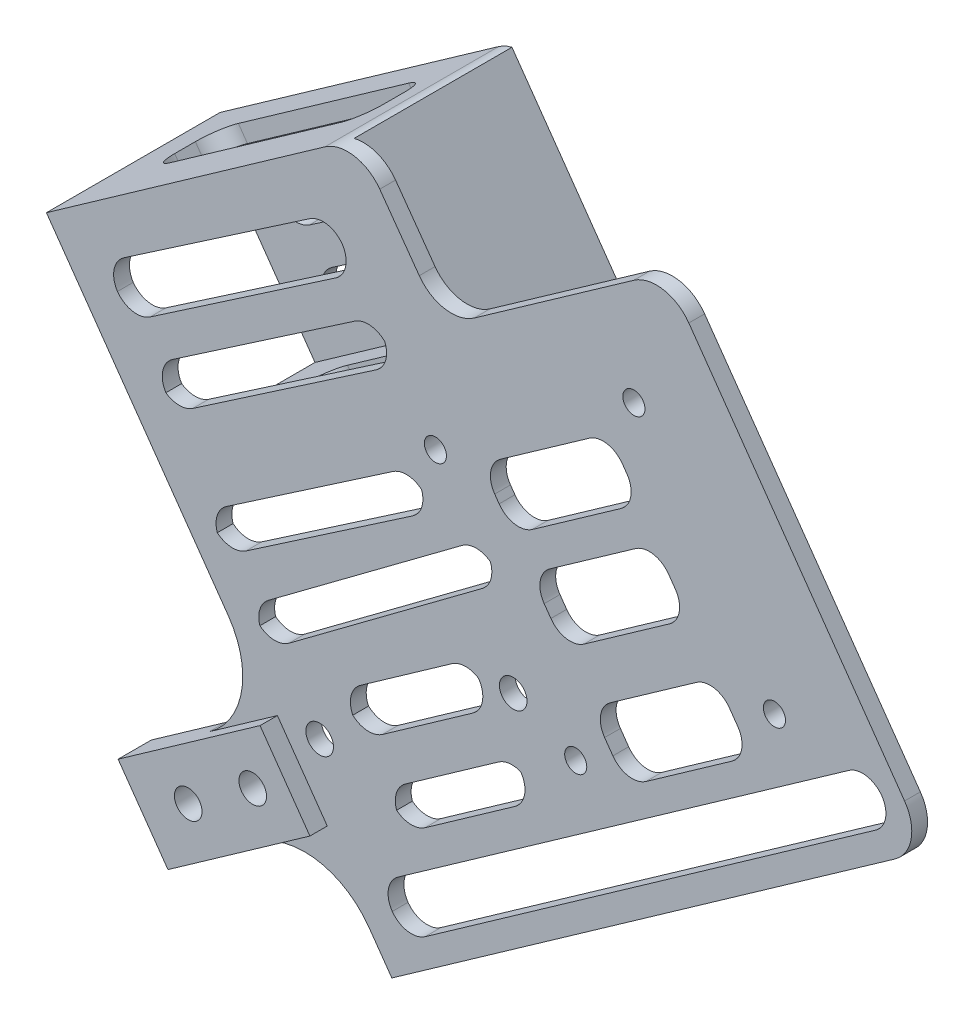
from build123d import *

# Parameters (mm, degrees)
SKETCH_1_R                = 2.1
EXTRUDE_1_DEPTH           = 2
EXTRUDE_2_DEPTH           = 40
EXTRUDE_3_DEPTH           = 2
FILLET_1_R                = 10
SKETCH_10_R               = 2.075
EXTRUDE_4_DEPTH           = 2
SKETCH_14_R               = 3.5715559825460215
CUT_EXTRUDE_6_DEPTH       = 4
SKETCH_15_R               = 2.075
EXTRUDE_6_DEPTH           = 2
SKETCH_16_R               = 3.75
CUT_EXTRUDE_7_DEPTH       = 2
FILLET_6_R                = 10
EXTRUDE_7_DEPTH           = 2
FILLET_7_R                = 10
CUT_EXTRUDE_8_DEPTH       = 39.00000000000002
CUT_EXTRUDE_9_DEPTH       = 1
CUT_EXTRUDE_9_DEPTH_BACK  = 1
EXTRUDE_8_DEPTH           = 20
EXTRUDE_9_DEPTH           = 43
SKETCH_23_R               = 1.7500000000000038
CUT_EXTRUDE_10_DEPTH      = 32
EXTRUDE_11_DEPTH          = 2.0000000000000036
M3X0_5_1_D                = 2.8
CUT_EXTRUDE_11_DEPTH      = 61.00000000000001
CUT_EXTRUDE_11_DEPTH_BACK = 9.000000000000002
CUT_EXTRUDE_12_DEPTH      = 9.000000000000002
SKETCH_32_W               = 32.392419007521774
SKETCH_32_H               = 8.622442469611897
CUT_EXTRUDE_13_DEPTH      = 43.000000000000014
FILLET_START              = -21
FILLET_8_DEPTH            = 24
FILLET_8_2_DEPTH          = 2
FILLET_10_R               = 3
FILLET_11_R               = 3
SKETCH_33_W               = 2.00000000000002
SKETCH_33_H               = 10.963872604458993
CUT_EXTRUDE_14_DEPTH      = 55.000000000000014
CUT_EXTRUDE_15_DEPTH      = 55.000000000000014
CUT_EXTRUDE_15_DEPTH_BACK = 55.000000000000014
EXTRUDE_12_DEPTH          = 21.99999999999999
CUT_EXTRUDE_17_DEPTH      = 10
CUT_EXTRUDE_17_DEPTH_BACK = 7.9999999999999964
SKETCH_36_R               = 1.7500000000000104
SKETCH_36_R_2             = 1.7500000000000004


with BuildPart() as part:
    # 草图1 → 凸台-拉伸1 (new body)
    with BuildSketch(Plane.XY):
        with BuildLine():
            Line((5.715095935783956, 0), (15.341111112939824, 6.784600591097247))
            Line((15.341111112939824, 6.784600591097247), (38.41017826776328, 23.044122706345174))
            Line((38.41017826776328, 23.044122706345174), (47.05172428264273, 10.78346683185294))
            Line((47.05172428264273, 10.78346683185294), (83.8336919061195, 36.708104876491305))
            Line((83.8336919061195, 36.708104876491305), (40.07067186746126, 98.79923160296066))
            Line((40.07067186746126, 98.79923160296066), (3.288704243984547, 72.87459355832229))
            Line((3.288704243984547, 72.87459355832229), (32.093857626916076, 32.00574064334817))
            Line((32.093857626916076, 32.00574064334817), (-1.7283092029758853, 8.167227110682408))
            Line((-1.7283092029758853, 8.167227110682408), (0, 5.715095935783956))
            ThreePointArc((0, 5.715095935783956), (-4.0411830913245135, -4.041183091324513), (5.715095935783956, 0))
        make_face()
        Circle(SKETCH_1_R, mode=Mode.SUBTRACT)
        with BuildLine():
            Line((7.071067811864017, 9.899494936610912), (6.585786437625429, 9.414213562372302))
            ThreePointArc((6.585786437625429, 9.414213562372302), (6.585786437625458, 6.585786437626118), (9.41421356237164, 6.58578643762615))
            Line((9.41421356237164, 6.58578643762615), (9.899494936610207, 7.071067811864724))
            ThreePointArc((9.899494936610207, 7.071067811864724), (9.899494936610207, 9.899494936610912), (7.071067811864017, 9.899494936610912))
        make_face(mode=Mode.SUBTRACT)
    extrude(amount=EXTRUDE_1_DEPTH)

    # 草图2 → 凸台-拉伸2 (add)
    with BuildSketch(Plane.XY.offset(2)):
        Polygon((4.152858845472472, 71.64852797087305), (39.70876088149996, 96.70901141402354), (81.74347171718236, 37.07001586245262), (46.187569681154784, 12.009532419302161), (47.05172428264273, 10.783466831852932), (83.8336919061195, 36.708104876491305), (40.07067186746126, 98.79923160296066), (3.288704243984547, 72.87459355832229), align=None)
    extrude(amount=-EXTRUDE_2_DEPTH)

    # 草图4 → 凸台-拉伸3 (add)
    with BuildSketch(Plane(origin=(0, 0, -38), x_dir=(-1, 0, 0), z_dir=(0, 0, -1))):
        Polygon((-83.8336919061195, 36.708104876491305), (-47.05172428264273, 10.783466831852936), (-3.288704243984547, 72.87459355832229), (-40.07067186746126, 98.79923160296066), align=None)
    extrude(amount=EXTRUDE_3_DEPTH)

    # 圆角1
    fillet_1_edges = [part.edges().sort_by_distance(p)[0] for p in [
        (32.093857626916076, 32.00574064334817, 1),
        (38.41017826776328, 23.044122706345174, 1),
    ]]
    fillet(fillet_1_edges, radius=FILLET_1_R)

    # 草图10 → 凸台-拉伸4 (add)
    with BuildSketch(Plane.XY.offset(2)):
        with BuildLine():
            Line((8.031882820422537, 15.046398123036559), (14.348203461269724, 6.084780186033628))
            Line((14.348203461269724, 6.084780186033628), (5.715095935783956, 0))
            ThreePointArc((5.715095935783956, 0), (-4.0411830913245135, -4.041183091324513), (0, 5.715095935783956))
            Line((0, 5.715095935783956), (-1.7283092029758853, 8.167227110682408))
            Line((-1.7283092029758853, 8.167227110682408), (8.031882820422537, 15.046398123036559))
        make_face()
        Circle(SKETCH_10_R, mode=Mode.SUBTRACT)
        with BuildLine():
            Line((7.071067811864017, 9.899494936610912), (6.58578643762543, 9.4142135623723))
            ThreePointArc((6.58578643762543, 9.4142135623723), (6.585786437625461, 6.585786437626118), (9.414213562371643, 6.58578643762615))
            Line((9.414213562371643, 6.58578643762615), (9.899494936610205, 7.071067811864723))
            ThreePointArc((9.899494936610205, 7.071067811864723), (9.899494936610207, 9.899494936610912), (7.071067811864017, 9.899494936610912))
        make_face(mode=Mode.SUBTRACT)
    extrude(amount=EXTRUDE_4_DEPTH)

    # 草图14 → 切除-拉伸6 (cut)
    with BuildSketch(Plane(origin=(0, 0, 0), x_dir=(-1, 0, 0), z_dir=(0, 0, -1))):
        with Locations((-7.999999999998536, 7.999999999999225)):
            Circle(SKETCH_14_R)
    extrude(amount=-CUT_EXTRUDE_6_DEPTH, mode=Mode.SUBTRACT)

    # 草图15 → 凸台-拉伸6 (add)
    with BuildSketch(Plane.XY.offset(4)):
        with BuildLine():
            Line((8.031882820422537, 15.046398123036559), (-1.7283092029758853, 8.167227110682408))
            Line((-1.7283092029758853, 8.167227110682408), (3.5e-16, 5.715095935783956))
            ThreePointArc((3.5e-16, 5.715095935783956), (-4.0411830913245135, -4.041183091324513), (5.715095935783956, 0))
            Line((5.715095935783956, 0), (14.348203461269724, 6.084780186033628))
            Line((14.348203461269724, 6.084780186033628), (8.031882820422537, 15.046398123036559))
        make_face()
        Circle(SKETCH_15_R, mode=Mode.SUBTRACT)
        with BuildLine():
            Line((7.071067811864017, 9.899494936610912), (6.58578643762543, 9.4142135623723))
            ThreePointArc((6.58578643762543, 9.4142135623723), (6.585786437625461, 6.585786437626118), (9.414213562371643, 6.58578643762615))
            Line((9.414213562371643, 6.58578643762615), (9.899494936610205, 7.071067811864723))
            ThreePointArc((9.899494936610205, 7.071067811864723), (9.899494936610207, 9.899494936610912), (7.071067811864017, 9.899494936610912))
        make_face(mode=Mode.SUBTRACT)
    extrude(amount=EXTRUDE_6_DEPTH)

    # 草图16 → 切除-拉伸7 (cut)
    with BuildSketch(Plane(origin=(0, 0, 0), x_dir=(-1, 0, 0), z_dir=(0, 0, -1))):
        Circle(SKETCH_16_R)
    extrude(amount=-CUT_EXTRUDE_7_DEPTH, mode=Mode.SUBTRACT)

    # 圆角6
    # the kernel refuses this fillet: 10 mm, written as the material it adds along each edge
    with BuildSketch(Plane(origin=(8.031882820422537, 15.046398123036559, 2), x_dir=(0.8173770582994835, 0.5761030676586291, 0), z_dir=(0.5761030676586291, -0.8173770582994835, 0))) as fillet_6_piece_1:
        with BuildLine():
            CenterArc((8, 10.000000000000002), FILLET_6_R, 216.86989764584402, 53.13010235415595)
            Line((0, 4.000000000000001), (-0.16000000000000011, 3.880000000000001))
            ThreePointArc((-0.16000000000000011, 3.880000000000001), (-0.2000000000000005, 2.0000000000000004), (-0.20000000000000007, 0))
            Line((-0.20000000000000007, 0), (-1.02e-15, -0.2))
            Line((-1.02e-15, -0.2), (8, -0.2))
            Line((8, -0.2), (8, 0))
        make_face()
    extrude(amount=10.963872604458924)

    # 草图17 → 凸台-拉伸7 (add)
    with BuildSketch(Plane(origin=(0, 0, 0), x_dir=(-1, 0, 0), z_dir=(0, 0, -1))):
        Polygon((-10.201001162752062, 16.57523443969374), (-16.517321803599266, 7.613616502690797), (-75.19214589124006, 48.96876075098351), (-68.87582525039278, 57.93037868798654), align=None)
    extrude(amount=EXTRUDE_7_DEPTH)

    # 圆角7
    # the kernel refuses this fillet: 10 mm, written as the material it adds along each edge
    with BuildSketch(Plane(origin=(10.201001162752062, 16.57523443969374, 0), x_dir=(-0.8173770582994832, -0.5761030676586293, 0), z_dir=(0.5761030676586294, -0.8173770582994833, 0))) as fillet_7_piece_1_section:
        with BuildLine():
            CenterArc((6.000000000000635, 10), FILLET_7_R, 233.13010235415305, 36.86989764584695)
            Line((2.2818e-13, 2.0000000000003038), (0, 0))
            Line((0, 0), (6.000000000000635, 0))
        make_face()
    fillet_7_piece_1 = extrude(amount=10.963872604458945, mode=Mode.PRIVATE)
    fillet_7_piece_1 = fillet_7_piece_1 - Plane(origin=(7.999999999998536, 7.999999999999225, 0), x_dir=(-1, 0, 0), z_dir=(0, 0, -1)) * Cylinder(3.5715559825460215, 46, mode=Mode.PRIVATE)
    add(fillet_7_piece_1)

    # 草图18 → 切除-拉伸8 (cut)
    with BuildSketch(Plane(origin=(0, 0, -40), x_dir=(-1, 0, 0), z_dir=(0, 0, -1))):
        Polygon((-40.07067186746127, 98.79923160296067), (-3.288704243984547, 72.87459355832229), (-47.05172428264273, 10.783466831852936), (-83.8336919061195, 36.708104876491305), align=None)
    extrude(amount=-CUT_EXTRUDE_8_DEPTH, mode=Mode.SUBTRACT)

    # 草图19 → 切除-拉伸9 (cut, two sides: drawn at the far end of the back side and taken through both)
    with BuildSketch(Plane(origin=(0, 0, -0.99999999999998), x_dir=(-1, 0, 0), z_dir=(0, 0, -1)).offset(-CUT_EXTRUDE_9_DEPTH_BACK)):
        Polygon((-3.288704243984547, 72.87459355832229), (-40.07067186746127, 98.79923160296067), (-83.8336919061195, 36.708104876491305), (-47.05172428264273, 10.783466831852936), (-46.18756968115477, 12.00953241930218), (-81.74347171718236, 37.07001586245262), (-73.96608030379087, 48.1046061494956), (-38.410178267763285, 23.044122706345178), (-32.09385762691605, 32.005740643348155), (-67.6497596629436, 57.06622408649863), (-39.708760881499984, 96.70901141402356), (-4.152858845472495, 71.64852797087306), align=None)
    extrude(amount=CUT_EXTRUDE_9_DEPTH + CUT_EXTRUDE_9_DEPTH_BACK, mode=Mode.SUBTRACT)

    # 草图21 → 凸台-拉伸8 (add)
    with BuildSketch(Plane(origin=(0, 0, 0), x_dir=(-1, 0, 0), z_dir=(0, 0, -1))):
        Polygon((-4.440910379301805, 71.23983944172332), (-3.288704243984547, 72.87459355832229), (-40.07067186746127, 98.79923160296067), (-55.049351626585654, 77.54742808717405), (-18.267384003108916, 51.62279004253576), (-17.115177867791655, 53.25754415913473), (-52.262391374669434, 78.02997606845577), (-39.588123886179574, 96.0122713510444), align=None)
    extrude(amount=EXTRUDE_8_DEPTH)

    # 草图22 → 凸台-拉伸9 (add)
    with BuildSketch(Plane(origin=(71.66058146886564, 50.50775574776218, 0), x_dir=(0, 0, 1), z_dir=(-0.817377058299483, -0.5761030676586297, 0))):
        Polygon((-20, 55.671388303890474), (-18.2, 55.671388303890474), (-18.199999999999996, 33.67138830389047), (-20, 33.67138830389047), align=None)
    extrude(amount=EXTRUDE_9_DEPTH)

    # 草图23 → 切除-拉伸10 (cut)
    with BuildSketch(Plane(origin=(0, 0, 0), x_dir=(-1, 0, 0), z_dir=(0, 0, -1))):
        with Locations((-37.90905212138934, 32.434124806742865)):
            Circle(SKETCH_23_R)
        with Locations((-62.43036387037384, 49.717216836501734)):
            Circle(SKETCH_23_R)
    extrude(amount=-CUT_EXTRUDE_10_DEPTH, mode=Mode.SUBTRACT)

    # 草图24 → 凸台-拉伸11 (add)
    with BuildSketch(Plane.XY.offset(2)):
        Polygon((83.8336919061195, 36.708104876491305), (40.07067186746127, 98.79923160296067), (71.13100008284161, 120.69114817398862), (114.89402012149985, 58.600021447519275), align=None)
    extrude(amount=-EXTRUDE_11_DEPTH)

    # M3x0.5 螺纹孔1 (through all)
    with Locations(Plane(origin=(0, 0, 0), x_dir=(-1, 0, 0), z_dir=(0, 0, -1))):
        with Locations((-52.570138543, 71.518041511), (-70.348679211, 46.293785492), (-95.527166458, 63.980975204), (-77.720830627, 89.244732903)):
            Hole(M3X0_5_1_D / 2)

    # 草图30 → 切除-拉伸11 (cut, two sides: drawn at the far end of the back side and taken through both)
    with BuildSketch(Plane(origin=(0, 0, 0), x_dir=(-1, 0, 0), z_dir=(0, 0, -1)).offset(-CUT_EXTRUDE_11_DEPTH_BACK)):
        Polygon((-110.82692528953335, 59.40373153966725), (-107.41459612000592, 64.24515616507918), (-45.39560218416546, 20.53297670426469), (-48.8079313536929, 15.691552078852727), align=None)
        Polygon((-48.80793135369289, 27.650857852557387), (-46.31007453974703, 31.19482588406629), (-62.60146912044069, 42.67731404430527), (-65.09932593438657, 39.13334601279635), align=None)
        Polygon((-43.46911835731699, 35.22558450611264), (-59.760512938010656, 46.70807266635163), (-56.95362864403973, 50.69048997323613), (-40.556312151489024, 39.13334601279635), align=None)
        Polygon((-31.51288633622315, 39.13334601279635), (-60.918711059524995, 61.052152622417715), (-58.3570707910252, 64.48879705663575), (-29.095229220949626, 42.67731404430526), align=None)
        Polygon((-26.09074219982254, 46.70807266635163), (-52.15495056838951, 64.48879705663575), (-49.675206086470844, 68.12377701914218), (-23.610997717903878, 50.34305262885806), align=None)
        Polygon((-19.725603614804214, 59.2334148240002), (-47.55900294671991, 78.22106238142037), (-44.841022196812105, 82.20526544606386), (-16.35216983908442, 62.77047483952678), align=None)
        Polygon((-13.940076546018872, 66.30628703788899), (-42.42892890374655, 85.74107764442608), (-39.12284638410603, 90.58736071952248), (-10.633994026378353, 71.15257011298539), align=None)
        Polygon((-76.78552232302457, 46.70807266635163), (-92.60127958902243, 57.855322501380925), (-88.09760195566247, 64.24515616507918), (-72.28184468966458, 53.0979063300499), align=None)
        Polygon((-68.92872629393347, 57.855322501380925), (-84.69340095602348, 68.96656833493195), (-80.38944036995649, 75.07304274961243), (-64.62476570786649, 63.96179691606138), align=None)
        Polygon((-58.3570707910252, 72.85442450484904), (-74.53368350634457, 84.25601219928431), (-78.5517126278179, 78.55521835206666), (-62.37509991249855, 67.15363065763138), align=None)
    extrude(amount=CUT_EXTRUDE_11_DEPTH + CUT_EXTRUDE_11_DEPTH_BACK, mode=Mode.SUBTRACT)

    # 草图31 → 切除-拉伸12 (cut)
    with BuildSketch(Plane(origin=(0, 0, 0), x_dir=(-1, 0, 0), z_dir=(0, 0, -1))):
        Polygon((-42.631920866610876, 100.60444914664545), (-53.41782577998694, 85.54871581236304), (-81.80043116076382, 105.5533218408563), (-71.13100008284161, 120.69114817398862), align=None)
    extrude(amount=-CUT_EXTRUDE_12_DEPTH, mode=Mode.SUBTRACT)

    # 草图32 → 切除-拉伸13 (cut)
    with BuildSketch(Plane(origin=(-18.24598395887897, 25.887466204094725, 0), x_dir=(0.8173770582994834, 0.5761030676586292, 0), z_dir=(0.5761030676586292, -0.8173770582994835, 0))):
        with Locations((67.66927289758625, -9.999246119121606)):
            Rectangle(SKETCH_32_W, SKETCH_32_H)
    extrude(amount=-CUT_EXTRUDE_13_DEPTH, mode=Mode.SUBTRACT)

    # 圆角8: read off the stored shape, not the designer's step
    # 圆角8 outline → 圆角8 (cut)
    with BuildSketch(Plane.XY.offset(FILLET_START)):
        with BuildLine():
            Line((114.894020122, 58.600021448), (112.013504783, 62.686906739))
            ThreePointArc((112.013504783, 62.686906739), (112.853315724, 58.953359026), (110.80713483, 55.719506109))
            Line((110.80713483, 55.719506109), (114.894020122, 58.600021448))
        make_face()
        with BuildLine():
            Line((45.521477001, 96.571001145), (42.631920867, 100.604449147))
            Line((42.631920867, 100.604449147), (38.576360016, 97.746011877))
            ThreePointArc((38.576360016, 97.746011877), (42.290948284, 98.589068), (45.521477001, 96.571001145))
        make_face()
        with BuildLine():
            ThreePointArc((77.713545869, 102.672806503), (81.447093582, 103.512617444), (84.680946499, 101.466436549))
            Line((84.680946499, 101.466436549), (81.800431161, 105.553321841))
            Line((81.800431161, 105.553321841), (77.713545869, 102.672806503))
        make_face()
    extrude(amount=FILLET_8_DEPTH, mode=Mode.SUBTRACT)

    # Fillet 8 2 outline → Fillet 8 2 (add)
    with BuildSketch(Plane.XY):
        with BuildLine():
            Line((53.41782578, 85.548715812), (57.47338663, 88.407153082))
            ThreePointArc((57.47338663, 88.407153082), (53.758798362, 87.564096959), (50.528269645, 89.582163814))
            Line((50.528269645, 89.582163814), (53.41782578, 85.548715812))
        make_face()
    extrude(amount=FILLET_8_2_DEPTH)

    # 圆角10
    # the kernel refuses this fillet: 3 mm, written as the material it adds along each edge
    with BuildSketch(Plane(origin=(23.82691717962884, 55.54125592706461, -5.6880248843156584), x_dir=(0.8173770582994834, 0.576103067658629, 0), z_dir=(-0.5761030676586291, 0.8173770582994834, 0))) as fillet_10_piece_1:
        with BuildLine():
            CenterArc((FILLET_10_R, FILLET_10_R), FILLET_10_R, 180, 90)
            Line((1.079e-14, FILLET_10_R), (0, 0))
            Line((0, 0), (FILLET_10_R, 0))
        make_face()
    extrude(amount=1.9999999999999785)
    with BuildSketch(Plane(origin=(23.82691717962884, 55.54125592706461, -14.310467353927557), x_dir=(0.8173770582994834, 0.5761030676586291, 0), z_dir=(-0.5761030676586291, 0.8173770582994834, 0))) as fillet_10_piece_2:
        with BuildLine():
            CenterArc((FILLET_10_R, -FILLET_10_R), FILLET_10_R, 90, 90)
            Line((-1.861e-14, -FILLET_10_R), (0, 0))
            Line((0, 0), (FILLET_10_R, 0))
        make_face()
    extrude(amount=1.9999999999999785)
    with BuildSketch(Plane(origin=(50.30373733920126, 74.20262788618159, -14.310467353927557), x_dir=(0, 0, 1), z_dir=(-0.5761030676586291, 0.8173770582994834, 0))) as fillet_10_piece_3:
        with BuildLine():
            CenterArc((FILLET_10_R, -FILLET_10_R), FILLET_10_R, 90, 90.00000000000006)
            Line((0, -FILLET_10_R), (0, 0))
            Line((0, 0), (FILLET_10_R, 0))
        make_face()
    extrude(amount=1.9999999999999862)
    with BuildSketch(Plane(origin=(50.30373733920126, 74.20262788618159, -5.6880248843156584), x_dir=(-0.8173770582994834, -0.5761030676586291, 0), z_dir=(-0.5761030676586291, 0.8173770582994834, 0))) as fillet_10_piece_4:
        with BuildLine():
            CenterArc((FILLET_10_R, -FILLET_10_R), FILLET_10_R, 90.00000000000003, 89.99999999999997)
            Line((-2.472e-14, -FILLET_10_R), (0, 0))
            Line((0, 0), (FILLET_10_R, 0))
        make_face()
    extrude(amount=1.9999999999999862)
    with BuildSketch(Plane(origin=(10.000443555821768, 75.15830532625218, -5.6880248843156584), x_dir=(4e-16, 2.8e-16, -1), z_dir=(-0.5761030676586291, 0.8173770582994834, 0))) as fillet_10_piece_5:
        with BuildLine():
            CenterArc((FILLET_10_R, -FILLET_10_R), FILLET_10_R, 90.00000000000003, 90.00000000000023)
            Line((5.6e-16, -FILLET_10_R), (0, 0))
            Line((0, 0), (FILLET_10_R, 0))
        make_face()
    extrude(amount=2.000000000000003)
    with BuildSketch(Plane(origin=(10.000443555821768, 75.15830532625218, -14.310467353927557), x_dir=(4e-16, 2.8e-16, 1), z_dir=(-0.5761030676586291, 0.8173770582994834, 0))) as fillet_10_piece_6:
        with BuildLine():
            CenterArc((FILLET_10_R, FILLET_10_R), FILLET_10_R, 180.0000000000002, 89.99999999999977)
            Line((1.45e-15, FILLET_10_R), (0, 0))
            Line((0, 0), (FILLET_10_R, 0))
        make_face()
    extrude(amount=2.000000000000003)
    with BuildSketch(Plane(origin=(36.47726371539417, 93.81967728536918, -5.6880248843156584), x_dir=(-0.8173770582994834, -0.5761030676586291, 0), z_dir=(-0.5761030676586291, 0.8173770582994834, 0))) as fillet_10_piece_7:
        with BuildLine():
            CenterArc((FILLET_10_R, -FILLET_10_R), FILLET_10_R, 90.00000000000003, 89.99999999999997)
            Line((-2.472e-14, -FILLET_10_R), (0, 0))
            Line((0, 0), (FILLET_10_R, 0))
        make_face()
    extrude(amount=2.0000000000000417)
    with BuildSketch(Plane(origin=(36.47726371539417, 93.81967728536918, -14.310467353927557), x_dir=(-0.8173770582994834, -0.5761030676586291, 0), z_dir=(-0.5761030676586291, 0.8173770582994834, 0))) as fillet_10_piece_8:
        with BuildLine():
            CenterArc((FILLET_10_R, FILLET_10_R), FILLET_10_R, 180, 90)
            Line((0, FILLET_10_R), (0, 0))
            Line((0, 0), (FILLET_10_R, 0))
        make_face()
    extrude(amount=2.0000000000000417)
    with BuildSketch(Plane(origin=(13.940076546018872, 66.30628703788899, -18.199999999999996), x_dir=(0.8260846178646836, 0.5635460976063625, 0), z_dir=(0, 0, -1))) as fillet_10_piece_9:
        with BuildLine():
            CenterArc((FILLET_10_R, -FILLET_10_R), FILLET_10_R, 89.99999999999974, 90.00000000000023)
            Line((-1.189e-14, -FILLET_10_R), (0, 0))
            Line((0, 0), (FILLET_10_R, -2e-16))
        make_face()
    extrude(amount=1.8000000000000043)
    with BuildSketch(Plane(origin=(19.725603614804214, 59.2334148240002, -18.199999999999996), x_dir=(0.8260846178646816, 0.5635460976063652, 0), z_dir=(0, 0, -1))) as fillet_10_piece_10:
        with BuildLine():
            CenterArc((FILLET_10_R * 0.84892895733, -FILLET_10_R), FILLET_10_R, 90.00000000000006, 80.65778296614056)
            Line((-FILLET_10_R * 0.137807417263, -FILLET_10_R * 0.837669081643), (0, 0))
            Line((0, 0), (FILLET_10_R * 0.84892895733, 2.1e-16))
        make_face()
    extrude(amount=1.8000000000000043)
    with BuildSketch(Plane(origin=(16.35216983908442, 62.77047483952678, -18.199999999999996), x_dir=(0.6901705079270946, -0.7236467853778225, 0), z_dir=(0, 0, -1))) as fillet_10_piece_11:
        with BuildLine():
            CenterArc((FILLET_10_R * 1.17795487051, -FILLET_10_R), FILLET_10_R, 90, 99.34221703385924)
            Line((FILLET_10_R * 0.191218495913, -FILLET_10_R * 1.16233091836), (0, 0))
            Line((0, 0), (FILLET_10_R * 1.17795487051, 8e-17))
        make_face()
    extrude(amount=1.8000000000000043)
    with BuildSketch(Plane(origin=(10.633994026378353, 71.15257011298539, -18.199999999999996), x_dir=(0.5635460976063638, -0.8260846178646827, 0), z_dir=(0, 0, -1))) as fillet_10_piece_12:
        with BuildLine():
            CenterArc((FILLET_10_R, -FILLET_10_R), FILLET_10_R, 90.00000000000006, 89.99999999999983)
            Line((-4.7e-16, -FILLET_10_R), (0, 0))
            Line((0, 0), (FILLET_10_R, -2.1e-16))
        make_face()
    extrude(amount=1.8000000000000043)
    with BuildSketch(Plane(origin=(39.12284638410603, 90.58736071952248, -20), x_dir=(-0.8260846178646831, -0.5635460976063631, 0), z_dir=(0, 0, 1)), Plane(origin=(44.841022196812105, 82.20526544606386, -20), x_dir=(-0.8260846178646831, -0.5635460976063631, 0), z_dir=(0, 0, 1))) as fillet_10_piece_13:
        with BuildLine():
            CenterArc((FILLET_10_R, FILLET_10_R), FILLET_10_R, 179.9999999999997, 90.00000000000051)
            Line((-7.62e-15, FILLET_10_R), (0, 0))
            Line((0, 0), (FILLET_10_R, -1.1e-16))
        make_face()
    extrude(amount=1.8000000000000043)
    with BuildSketch(Plane(origin=(42.42892890374655, 85.74107764442608, -20), x_dir=(-0.8260846178646831, -0.5635460976063631, 0), z_dir=(0, 0, 1))) as fillet_10_piece_14:
        with BuildLine():
            CenterArc((FILLET_10_R, -FILLET_10_R), FILLET_10_R, 90.0000000000002, 89.99999999999972)
            Line((4.08e-15, -FILLET_10_R), (0, 0))
            Line((0, 0), (FILLET_10_R, -1.1e-16))
        make_face()
    extrude(amount=1.8000000000000043)
    with BuildSketch(Plane(origin=(47.55900294671991, 78.22106238142037, -20), x_dir=(-0.8260846178646809, -0.5635460976063664, 0), z_dir=(0, 0, 1))) as fillet_10_piece_15:
        with BuildLine():
            CenterArc((FILLET_10_R, -FILLET_10_R), FILLET_10_R, 89.99999999999996, 89.99999999999982)
            Line((-1.972e-14, -FILLET_10_R), (0, 0))
            Line((0, 0), (FILLET_10_R, -9e-17))
        make_face()
    extrude(amount=1.8000000000000043)
    with BuildSketch(Plane(origin=(19.725603614804214, 59.2334148240002, 2), x_dir=(0.8260846178646816, 0.5635460976063652, 0), z_dir=(0, 0, -1))) as fillet_10_piece_16:
        with BuildLine():
            CenterArc((FILLET_10_R * 0.84892895733, -FILLET_10_R), FILLET_10_R, 90.00000000000006, 80.65778296614056)
            Line((-FILLET_10_R * 0.137807417263, -FILLET_10_R * 0.837669081643), (0, 0))
            Line((0, 0), (FILLET_10_R * 0.84892895733, 2.1e-16))
        make_face()
    extrude(amount=2)
    with BuildSketch(Plane(origin=(13.940076546018872, 66.30628703788899, 2), x_dir=(0.8260846178646836, 0.5635460976063625, 0), z_dir=(0, 0, -1))) as fillet_10_piece_17:
        with BuildLine():
            CenterArc((FILLET_10_R, -FILLET_10_R), FILLET_10_R, 89.99999999999974, 90.00000000000023)
            Line((-1.189e-14, -FILLET_10_R), (0, 0))
            Line((0, 0), (FILLET_10_R, -2e-16))
        make_face()
    extrude(amount=2)
    with BuildSketch(Plane(origin=(16.35216983908442, 62.77047483952678, 2), x_dir=(0.6901705079270946, -0.7236467853778225, 0), z_dir=(0, 0, -1))) as fillet_10_piece_18:
        with BuildLine():
            CenterArc((FILLET_10_R * 1.17795487051, -FILLET_10_R), FILLET_10_R, 90, 99.34221703385924)
            Line((FILLET_10_R * 0.191218495913, -FILLET_10_R * 1.16233091836), (0, 0))
            Line((0, 0), (FILLET_10_R * 1.17795487051, 8e-17))
        make_face()
    extrude(amount=2)
    with BuildSketch(Plane(origin=(10.633994026378353, 71.15257011298539, 2), x_dir=(0.5635460976063638, -0.8260846178646827, 0), z_dir=(0, 0, -1))) as fillet_10_piece_19:
        with BuildLine():
            CenterArc((FILLET_10_R, -FILLET_10_R), FILLET_10_R, 90.00000000000006, 89.99999999999983)
            Line((-4.7e-16, -FILLET_10_R), (0, 0))
            Line((0, 0), (FILLET_10_R, -2.1e-16))
        make_face()
    extrude(amount=2)
    with BuildSketch(Plane(origin=(39.12284638410603, 90.58736071952248, 0), x_dir=(0.5635460976063636, -0.8260846178646828, 0), z_dir=(0, 0, 1)), Plane(origin=(44.841022196812105, 82.20526544606386, 0), x_dir=(0.5635460976063636, -0.8260846178646828, 0), z_dir=(0, 0, 1))) as fillet_10_piece_20:
        with BuildLine():
            CenterArc((FILLET_10_R, -FILLET_10_R), FILLET_10_R, 89.99999999999996, 89.99999999999993)
            Line((1.99e-15, -FILLET_10_R), (0, 0))
            Line((0, 0), (FILLET_10_R, -2e-16))
        make_face()
    extrude(amount=2)
    with BuildSketch(Plane(origin=(42.42892890374655, 85.74107764442608, 0), x_dir=(-0.8260846178646831, -0.5635460976063631, 0), z_dir=(0, 0, 1))) as fillet_10_piece_21:
        with BuildLine():
            CenterArc((FILLET_10_R, -FILLET_10_R), FILLET_10_R, 90.0000000000002, 89.99999999999972)
            Line((4.08e-15, -FILLET_10_R), (0, 0))
            Line((0, 0), (FILLET_10_R, -1.1e-16))
        make_face()
    extrude(amount=2)
    with BuildSketch(Plane(origin=(47.55900294671991, 78.22106238142037, 0), x_dir=(-0.8260846178646809, -0.5635460976063664, 0), z_dir=(0, 0, 1))) as fillet_10_piece_22:
        with BuildLine():
            CenterArc((FILLET_10_R, -FILLET_10_R), FILLET_10_R, 89.99999999999996, 89.99999999999982)
            Line((-1.972e-14, -FILLET_10_R), (0, 0))
            Line((0, 0), (FILLET_10_R, -9e-17))
        make_face()
    extrude(amount=2)
    with BuildSketch(Plane(origin=(52.15495056838951, 64.48879705663575, 0), x_dir=(-0.8260846178646812, -0.5635460976063658, 0), z_dir=(0, 0, 1))) as fillet_10_piece_23:
        with BuildLine():
            CenterArc((FILLET_10_R, -FILLET_10_R), FILLET_10_R, 89.99999999999993, 89.9999999999999)
            Line((-5.86e-15, -FILLET_10_R), (0, 0))
            Line((0, 0), (FILLET_10_R, 1.3e-16))
        make_face()
    extrude(amount=2)
    with BuildSketch(Plane(origin=(78.5517126278179, 78.55521835206666, 2), x_dir=(-0.8173770582994836, -0.5761030676586288, 0), z_dir=(0, 0, -1))) as fillet_10_piece_24:
        with BuildLine():
            CenterArc((FILLET_10_R, FILLET_10_R), FILLET_10_R, 179.99999999999994, 90)
            Line((-1.634e-14, FILLET_10_R), (0, 0))
            Line((0, 0), (FILLET_10_R, 4e-17))
        make_face()
    extrude(amount=2)
    with BuildSketch(Plane(origin=(84.69340095602348, 68.96656833493195, 0), x_dir=(-0.8173770582994814, -0.5761030676586321, 0), z_dir=(0, 0, 1))) as fillet_10_piece_25:
        with BuildLine():
            CenterArc((FILLET_10_R, -FILLET_10_R), FILLET_10_R, 89.99999999999984, 90.00000000000016)
            Line((-8.28e-15, -FILLET_10_R), (0, 0))
            Line((0, 0), (FILLET_10_R, -3e-17))
        make_face()
    extrude(amount=2)
    with BuildSketch(Plane(origin=(60.918711059524995, 61.052152622417715, 0), x_dir=(-0.8017706748573764, -0.597631813860965, 0), z_dir=(0, 0, 1))) as fillet_10_piece_26:
        with BuildLine():
            CenterArc((FILLET_10_R, -FILLET_10_R), FILLET_10_R, 89.99999999999993, 90.00000000000017)
            Line((-8.33e-15, -FILLET_10_R), (0, 0))
            Line((0, 0), (FILLET_10_R, 1.2e-16))
        make_face()
    extrude(amount=2)
    with BuildSketch(Plane(origin=(65.09932593438657, 39.13334601279635, 0), x_dir=(-0.8173770582994839, -0.5761030676586282, 0), z_dir=(0, 0, 1))) as fillet_10_piece_27:
        with BuildLine():
            CenterArc((FILLET_10_R, -FILLET_10_R), FILLET_10_R, 90, 90.00000000000017)
            Line((1.6e-15, -FILLET_10_R), (0, 0))
            Line((0, 0), (FILLET_10_R, -9e-17))
        make_face()
    extrude(amount=2)
    with BuildSketch(Plane(origin=(59.760512938010656, 46.70807266635163, 0), x_dir=(-0.8173770582994833, -0.5761030676586293, 0), z_dir=(0, 0, 1))) as fillet_10_piece_28:
        with BuildLine():
            CenterArc((FILLET_10_R, -FILLET_10_R), FILLET_10_R, 90, 90)
            Line((-4e-17, -FILLET_10_R), (0, 0))
            Line((0, 0), (FILLET_10_R, 9e-17))
        make_face()
    extrude(amount=2)
    with BuildSketch(Plane(origin=(92.60127958902243, 57.855322501380925, 0), x_dir=(-0.817377058299482, -0.5761030676586311, 0), z_dir=(0, 0, 1))) as fillet_10_piece_29:
        with BuildLine():
            CenterArc((FILLET_10_R, -FILLET_10_R), FILLET_10_R, 89.99999999999999, 90.00000000000006)
            Line((-2.036e-14, -FILLET_10_R), (0, 0))
            Line((0, 0), (FILLET_10_R, -6e-17))
        make_face()
    extrude(amount=2)
    with BuildSketch(Plane(origin=(110.82692528953335, 59.40373153966725, 2), x_dir=(-0.5761030676586297, 0.8173770582994829, 0), z_dir=(0, 0, -1))) as fillet_10_piece_30:
        with BuildLine():
            CenterArc((FILLET_10_R, -FILLET_10_R), FILLET_10_R, 90.00000000000011, 89.99999999999915)
            Line((1.262e-14, -FILLET_10_R), (0, 0))
            Line((0, 0), (FILLET_10_R, -1e-16))
        make_face()
    extrude(amount=2)
    with BuildSketch(Plane(origin=(107.41459612000592, 64.24515616507918, 0), x_dir=(0.5761030676586308, -0.817377058299482, 0), z_dir=(0, 0, 1))) as fillet_10_piece_31:
        with BuildLine():
            CenterArc((FILLET_10_R, -FILLET_10_R), FILLET_10_R, 89.99999999999982, 90.00000000000018)
            Line((-1.002e-14, -FILLET_10_R), (0, 0))
            Line((0, 0), (FILLET_10_R, -8e-17))
        make_face()
    extrude(amount=2)
    with BuildSketch(Plane(origin=(88.09760195566247, 64.24515616507918, 0), x_dir=(0.5761030676586277, -0.8173770582994844, 0), z_dir=(0, 0, 1))) as fillet_10_piece_32:
        with BuildLine():
            CenterArc((FILLET_10_R, -FILLET_10_R), FILLET_10_R, 90.00000000000003, 89.99999999999989)
            Line((-4.02e-15, -FILLET_10_R), (0, 0))
            Line((0, 0), (FILLET_10_R, -1e-17))
        make_face()
    extrude(amount=2)
    with BuildSketch(Plane(origin=(80.38944036995649, 75.07304274961243, 0), x_dir=(0.5761030676586297, -0.8173770582994829, 0), z_dir=(0, 0, 1))) as fillet_10_piece_33:
        with BuildLine():
            CenterArc((FILLET_10_R, -FILLET_10_R), FILLET_10_R, 90, 90)
            Line((-1e-17, -FILLET_10_R), (0, 0))
            Line((0, 0), (FILLET_10_R, 1e-16))
        make_face()
    extrude(amount=2)
    with BuildSketch(Plane(origin=(58.3570707910252, 64.48879705663575, 0), x_dir=(0.5976318138609646, -0.8017706748573767, 0), z_dir=(0, 0, 1))) as fillet_10_piece_34:
        with BuildLine():
            CenterArc((FILLET_10_R, -FILLET_10_R), FILLET_10_R, 89.99999999999994, 90)
            Line((-1.845e-14, -FILLET_10_R), (0, 0))
            Line((0, 0), (FILLET_10_R, 1e-16))
        make_face()
    extrude(amount=2)
    with BuildSketch(Plane(origin=(74.53368350634457, 84.25601219928431, 2), x_dir=(-0.8173770582994829, -0.5761030676586297, 0), z_dir=(0, 0, -1))) as fillet_10_piece_35:
        with BuildLine():
            CenterArc((FILLET_10_R, -FILLET_10_R), FILLET_10_R, 90, 90)
            Line((-1e-16, -FILLET_10_R), (0, 0))
            Line((0, 0), (FILLET_10_R, 1e-17))
        make_face()
    extrude(amount=2)
    with BuildSketch(Plane(origin=(49.675206086470844, 68.12377701914218, 0), x_dir=(0.5635460976063658, -0.8260846178646812, 0), z_dir=(0, 0, 1))) as fillet_10_piece_36:
        with BuildLine():
            CenterArc((FILLET_10_R, -FILLET_10_R), FILLET_10_R, 89.99999999999993, 90.00000000000011)
            Line((-1.374e-14, -FILLET_10_R), (0, 0))
            Line((0, 0), (FILLET_10_R, 1.4e-16))
        make_face()
    extrude(amount=2)
    with BuildSketch(Plane(origin=(46.31007453974703, 31.19482588406629, 2), x_dir=(0.5761030676586277, -0.8173770582994844, 0), z_dir=(0, 0, -1))) as fillet_10_piece_37:
        with BuildLine():
            CenterArc((FILLET_10_R, -FILLET_10_R), FILLET_10_R, 90.00000000000003, 89.99999999999991)
            Line((-5.78e-15, -FILLET_10_R), (0, 0))
            Line((0, 0), (FILLET_10_R, 1e-17))
        make_face()
    extrude(amount=2)
    with BuildSketch(Plane(origin=(72.28184468966458, 53.0979063300499, 2), x_dir=(0.5761030676586297, -0.8173770582994829, 0), z_dir=(0, 0, -1))) as fillet_10_piece_38:
        with BuildLine():
            CenterArc((FILLET_10_R, -FILLET_10_R), FILLET_10_R, 89.99999999999984, 90.00000000000034)
            Line((1e-17, -FILLET_10_R), (0, 0))
            Line((0, 0), (FILLET_10_R, -1e-16))
        make_face()
    extrude(amount=2)
    with BuildSketch(Plane(origin=(40.556312151489024, 39.13334601279635, 2), x_dir=(0.5976318138609636, -0.8017706748573775, 0), z_dir=(0, 0, -1))) as fillet_10_piece_39:
        with BuildLine():
            CenterArc((FILLET_10_R * 1.02695103949, -FILLET_10_R), FILLET_10_R, 89.99999999999997, 91.52355907541335)
            Line((FILLET_10_R * 0.0273045625469, -FILLET_10_R * 1.02658798862), (0, 0))
            Line((0, 0), (FILLET_10_R * 1.02695103949, -2.9e-16))
        make_face()
    extrude(amount=2)
    with BuildSketch(Plane(origin=(64.62476570786649, 63.96179691606138, 2), x_dir=(0.5761030676586297, -0.8173770582994829, 0), z_dir=(0, 0, -1))) as fillet_10_piece_40:
        with BuildLine():
            CenterArc((FILLET_10_R, -FILLET_10_R), FILLET_10_R, 90.00000000000011, 89.99999999999952)
            Line((9.22e-15, -FILLET_10_R), (0, 0))
            Line((0, 0), (FILLET_10_R, -1e-16))
        make_face()
    extrude(amount=2)
    with BuildSketch(Plane(origin=(29.095229220949626, 42.67731404430526, 2), x_dir=(0.5635460976063654, -0.8260846178646816, 0), z_dir=(0, 0, -1))) as fillet_10_piece_41:
        with BuildLine():
            CenterArc((FILLET_10_R * 0.958980834975, -FILLET_10_R), FILLET_10_R, 90.00000000000006, 87.60091410444892)
            Line((-FILLET_10_R * 0.0401426630865, -FILLET_10_R * 0.958140286414), (0, 0))
            Line((0, 0), (FILLET_10_R * 0.958980834975, 2.3e-16))
        make_face()
    extrude(amount=2)
    with BuildSketch(Plane(origin=(23.610997717903878, 50.34305262885806, 2), x_dir=(0.5635460976063658, -0.8260846178646812, 0), z_dir=(0, 0, -1))) as fillet_10_piece_42:
        with BuildLine():
            CenterArc((FILLET_10_R, -FILLET_10_R), FILLET_10_R, 90.00000000000004, 89.99999999999994)
            Line((-6e-15, -FILLET_10_R), (0, 0))
            Line((0, 0), (FILLET_10_R, -1.4e-16))
        make_face()
    extrude(amount=2)
    with BuildSketch(Plane(origin=(58.3570707910252, 72.85442450484904, 0), x_dir=(0.576103067658632, -0.8173770582994813, 0), z_dir=(0, 0, 1))) as fillet_10_piece_43:
        with BuildLine():
            CenterArc((FILLET_10_R, FILLET_10_R), FILLET_10_R, 179.99999999999974, 90.00000000000017)
            Line((-3.4e-15, FILLET_10_R), (0, 0))
            Line((0, 0), (FILLET_10_R, -4e-17))
        make_face()
    extrude(amount=2)
    with BuildSketch(Plane(origin=(26.09074219982254, 46.70807266635163, 2), x_dir=(0.8260846178646817, 0.5635460976063653, 0), z_dir=(0, 0, -1))) as fillet_10_piece_44:
        with BuildLine():
            CenterArc((FILLET_10_R, -FILLET_10_R), FILLET_10_R, 90.00000000000006, 89.9999999999998)
            Line((9.8e-16, -FILLET_10_R), (0, 0))
            Line((0, 0), (FILLET_10_R, 1e-17))
        make_face()
    extrude(amount=2)
    with BuildSketch(Plane(origin=(31.51288633622315, 39.13334601279635, 2), x_dir=(0.8017706748573766, 0.5976318138609645, 0), z_dir=(0, 0, -1))) as fillet_10_piece_45:
        with BuildLine():
            CenterArc((FILLET_10_R * 1.04277370676, -FILLET_10_R), FILLET_10_R, 90.00000000000006, 92.39908589555114)
            Line((FILLET_10_R * 0.0436502087001, -FILLET_10_R * 1.04185971359), (0, 0))
            Line((0, 0), (FILLET_10_R * 1.04277370676, 0))
        make_face()
    extrude(amount=2)
    with BuildSketch(Plane(origin=(76.78552232302457, 46.70807266635163, 2), x_dir=(0.8173770582994829, 0.5761030676586297, 0), z_dir=(0, 0, -1)), Plane(origin=(68.92872629393347, 57.855322501380925, 2), x_dir=(0.8173770582994829, 0.5761030676586297, 0), z_dir=(0, 0, -1))) as fillet_10_piece_46:
        with BuildLine():
            CenterArc((FILLET_10_R, -FILLET_10_R), FILLET_10_R, 89.99999999999993, 90.00000000000017)
            Line((-1e-16, -FILLET_10_R), (0, 0))
            Line((0, 0), (FILLET_10_R, 1e-17))
        make_face()
    extrude(amount=2)
    with BuildSketch(Plane(origin=(62.37509991249855, 67.15363065763138, 0), x_dir=(-0.576103067658632, 0.8173770582994813, 0), z_dir=(0, 0, 1))) as fillet_10_piece_47:
        with BuildLine():
            CenterArc((FILLET_10_R, -FILLET_10_R), FILLET_10_R, 89.99999999999993, 90.00000000000006)
            Line((-4.22e-15, -FILLET_10_R), (0, 0))
            Line((0, 0), (FILLET_10_R, -4e-17))
        make_face()
    extrude(amount=2)
    with BuildSketch(Plane(origin=(43.46911835731699, 35.22558450611264, 2), x_dir=(0.8173770582994833, 0.5761030676586292, 0), z_dir=(0, 0, -1))) as fillet_10_piece_48:
        with BuildLine():
            CenterArc((FILLET_10_R * 0.973756256674, -FILLET_10_R), FILLET_10_R, 90, 88.4764409245866)
            Line((-FILLET_10_R * 0.025890220267, -FILLET_10_R * 0.973412011384), (0, 0))
            Line((0, 0), (FILLET_10_R * 0.973756256674, 1.2e-16))
        make_face()
    extrude(amount=2)
    with BuildSketch(Plane(origin=(48.80793135369289, 27.650857852557387, 0), x_dir=(0.8173770582994838, 0.5761030676586285, 0), z_dir=(0, 0, 1))) as fillet_10_piece_49:
        with BuildLine():
            CenterArc((FILLET_10_R, FILLET_10_R), FILLET_10_R, 179.99999999999986, 90.00000000000017)
            Line((-4.65e-15, FILLET_10_R), (0, 0))
            Line((0, 0), (FILLET_10_R, -8e-17))
        make_face()
    extrude(amount=2)
    with BuildSketch(Plane(origin=(48.8079313536929, 15.691552078852727, 2), x_dir=(0.8173770582994835, 0.576103067658629, 0), z_dir=(0, 0, -1))) as fillet_10_piece_50:
        with BuildLine():
            CenterArc((FILLET_10_R, -FILLET_10_R), FILLET_10_R, 90.00000000000003, 90.00000000000011)
            Line((4.92e-15, -FILLET_10_R), (0, 0))
            Line((0, 0), (FILLET_10_R, -5e-17))
        make_face()
    extrude(amount=2)
    with BuildSketch(Plane(origin=(45.39560218416546, 20.53297670426469, 0), x_dir=(0.8173770582994832, 0.5761030676586295, 0), z_dir=(0, 0, 1))) as fillet_10_piece_51:
        with BuildLine():
            CenterArc((FILLET_10_R, -FILLET_10_R), FILLET_10_R, 89.99999999999994, 90.00000000000011)
            Line((1.301e-14, -FILLET_10_R), (0, 0))
            Line((0, 0), (FILLET_10_R, -2.7e-16))
        make_face()
    extrude(amount=2)

    # 圆角11
    # the kernel refuses this fillet: 3 mm, written as the material it adds along each edge
    with BuildSketch(Plane(origin=(56.95362864403973, 50.69048997323613, 0), x_dir=(-0.8173770582994829, -0.5761030676586296, 0), z_dir=(0, 0, 1))) as fillet_11_piece_1:
        with BuildLine():
            CenterArc((2.7799365641310985, 2.999999999999997), FILLET_11_R, 202.08219174695722, 67.91780825304272)
            Line((1.25508e-12, 1.8721911955415715), (-0.05559873128134191, 1.8496350194524))
            ThreePointArc((-0.05559873128134191, 1.8496350194524), (-0.06000000000000227, 0.9360955977707908), (-0.06000000000000117, -3.45e-15))
            Line((-0.06000000000000117, -3.45e-15), (3.45e-15, -0.06000000000000117))
            Line((3.45e-15, -0.06000000000000117), (2.7799365641311007, -0.06000000000000109))
            Line((2.7799365641311007, -0.06000000000000109), (2.779936564131097, 2.2e-16))
        make_face()
    extrude(amount=2)
    with BuildSketch(Plane(origin=(62.60146912044069, 42.67731404430527, 2), x_dir=(0.5761030676559975, -0.8173770583013382, 0), z_dir=(0, 0, -1))) as fillet_11_piece_2:
        with BuildLine():
            CenterArc((3.000000000008033, 2.496072029671577), FILLET_11_R, 179.99999999981551, 56.30721761238942)
            Line((8.03589e-12, 2.4960720296812364), (-0.05999999999196515, 2.496072029681433))
            Line((-0.05999999999196515, 2.496072029681433), (-0.06000000000000118, 1.9667e-13))
            Line((-0.06000000000000118, 1.9667e-13), (-1.9667e-13, -0.06000000000000118))
            ThreePointArc((-1.9667e-13, -0.06000000000000118), (0.6678905686951683, -0.06000000000215001), (1.3024967601383868, -0.04992144059343225))
            Line((1.3024967601383868, -0.04992144059343225), (1.3357811373907347, 3e-17))
        make_face()
    extrude(amount=2)

    # 草图33 → 切除-拉伸14 (cut)
    with BuildSketch(Plane(origin=(36.513367961987875, 25.735323838441115, 0), x_dir=(0, 0, -1), z_dir=(0.8173770582994829, 0.57610306765863, 0))):
        with Locations((0.99999999999999, 2.189452001660963)):
            Rectangle(SKETCH_33_W, SKETCH_33_H)
    extrude(amount=-CUT_EXTRUDE_14_DEPTH, mode=Mode.SUBTRACT)

    # 草图34 → 切除-拉伸15 (cut, two sides: drawn at the far end of the back side and taken through both)
    with BuildSketch(Plane.XY.offset(2).offset(-CUT_EXTRUDE_15_DEPTH_BACK)):
        Polygon((14.570899286818378, 19.65522266430562), (22.635216321359184, 8.213541296982628), (-2.151478194736771, -9.256597609960169), (-10.215795229277576, 2.185083757362823), align=None)
    extrude(amount=CUT_EXTRUDE_15_DEPTH + CUT_EXTRUDE_15_DEPTH_BACK, mode=Mode.SUBTRACT)

    # 草图35 → 凸台-拉伸12 (add)
    with BuildSketch(Plane(origin=(18.990409621890194, 13.384805859398618, 0), x_dir=(0, 0, 1), z_dir=(-0.8173770582994823, -0.5761030676586308, 0))):
        Polygon((1.999999999999995, 7.671388303890417), (4.199999999999996, 7.671388303890417), (4.1999999999999975, -3.292484300568549), (1.9999999999999962, -3.2924843005685496), align=None)
    extrude(amount=-EXTRUDE_12_DEPTH)

    # 草图36 → 切除-拉伸17 (cut, two sides: drawn at the far end of the back side and taken through both)
    with BuildSketch(Plane.XY.offset(-CUT_EXTRUDE_17_DEPTH_BACK)):
        with Locations(Location((31.624469598333217, 24.96816584600083, 0), (0, 0, 270))):
            Circle(SKETCH_36_R)
        with Locations(Location((23.450699015338383, 19.207135169414553, 0), (0, 0, 270))):
            Circle(SKETCH_36_R_2)
    extrude(amount=CUT_EXTRUDE_17_DEPTH + CUT_EXTRUDE_17_DEPTH_BACK, mode=Mode.SUBTRACT)


solid = part.part
